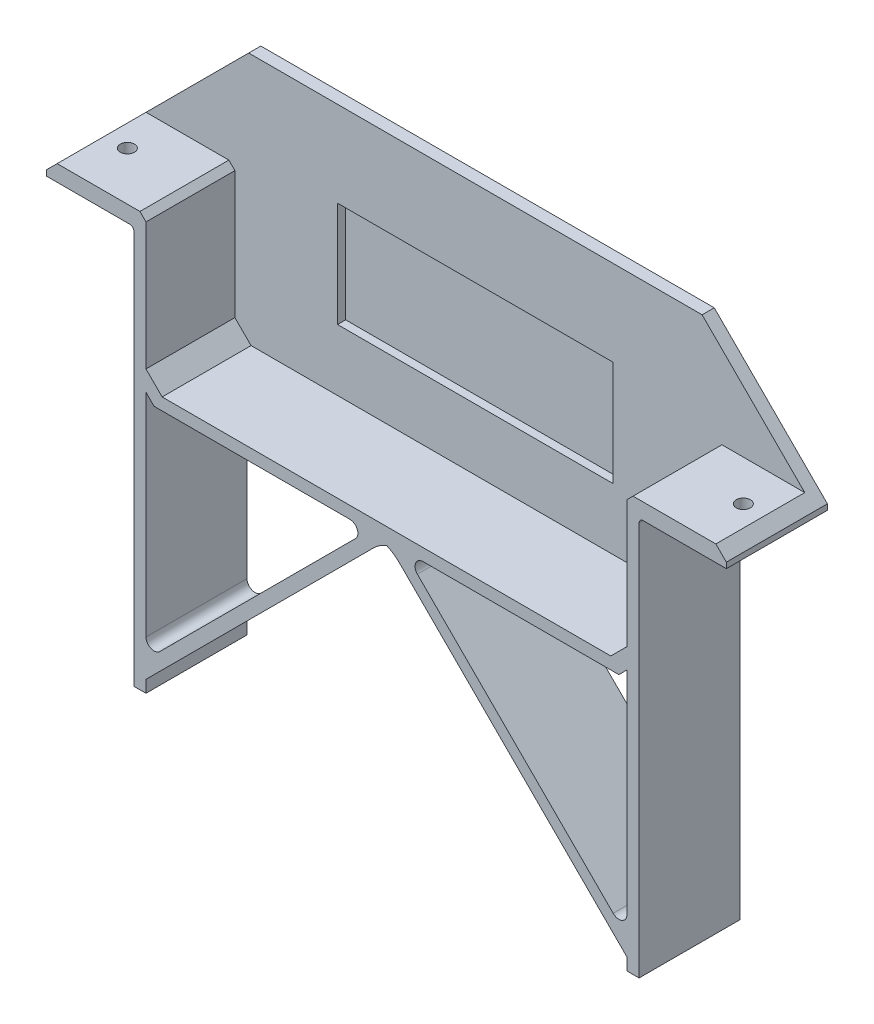
from build123d import *

# Parameters (mm, degrees)
SKETCH1_W            = 125
SKETCH1_H            = 40
BOSS_EXTRUDE1_DEPTH  = 3
SKETCH2_W            = 3
SKETCH2_H            = 40
BOSS_EXTRUDE2_DEPTH  = 22
SKETCH4_W            = 25
SKETCH4_H            = 4
BOSS_EXTRUDE4_DEPTH  = 21.59
SKETCH5_W            = 25
SKETCH5_H            = 4
BOSS_EXTRUDE5_DEPTH  = 21.59
SKETCH6_W            = 168.18
SKETCH6_H            = 25.4
BOSS_EXTRUDE6_DEPTH  = 3
CHAMFER1_SIZE        = 28
SKETCH7_W            = 68.2
SKETCH7_H            = 26
CUT_EXTRUDE1_DEPTH   = 2
SKETCH9_W            = 119
SKETCH9_H            = 3
BOSS_EXTRUDE7_DEPTH  = 22
CHAMFER2_SIZE        = 4
CHAMFER3_SIZE        = 5
SKETCH11_R           = 1.75
CUT_EXTRUDE3_DEPTH   = 5
FILLET1_R            = 1
CHAMFER4_SIZE        = 1.5
BOSS_EXTRUDE10_DEPTH = 25
FILLET2_R            = 10
FILLET3_R            = 2
FILLET4_R            = 2


with BuildPart() as part:
    # Sketch1 → Boss-Extrude1 (new body)
    with BuildSketch(Plane.XY):
        Rectangle(SKETCH1_W, SKETCH1_H)
    extrude(amount=BOSS_EXTRUDE1_DEPTH)

    # Sketch2 → Boss-Extrude2 (add)
    with BuildSketch(Plane.XY.offset(3)):
        with Locations((-61, 0)):
            Rectangle(SKETCH2_W, SKETCH2_H)
        with Locations((61, 0)):
            Rectangle(SKETCH2_W, SKETCH2_H)
    extrude(amount=BOSS_EXTRUDE2_DEPTH)

    # Sketch4 → Boss-Extrude4 (add)
    with BuildSketch(Plane.ZY.offset(62.5)):
        with Locations((12.5, 18)):
            Rectangle(SKETCH4_W, SKETCH4_H)
    extrude(amount=BOSS_EXTRUDE4_DEPTH)

    # Sketch5 → Boss-Extrude5 (add)
    with BuildSketch(Plane(origin=(62.5, 0, 0), x_dir=(0, 0, -1), z_dir=(1, 0, 0))):
        with Locations((-12.5, 18)):
            Rectangle(SKETCH5_W, SKETCH5_H)
    extrude(amount=BOSS_EXTRUDE5_DEPTH)

    # Sketch6 → Boss-Extrude6 (add)
    with BuildSketch(Plane(origin=(0, 0, 0), x_dir=(-1, 0, 0), z_dir=(0, 0, -1))):
        with Locations((0, 32.7)):
            Rectangle(SKETCH6_W, SKETCH6_H)
    extrude(amount=-BOSS_EXTRUDE6_DEPTH)

    # Chamfer1
    chamfer1_edges = [part.edges().sort_by_distance(p)[0] for p in [
        (-84.09, 45.4, 1.5),
        (84.09, 45.4, 1.5),
    ]]
    chamfer(chamfer1_edges, length=CHAMFER1_SIZE)

    # Sketch7 → Cut-Extrude1 (cut)
    with BuildSketch(Plane.XY.offset(3)):
        with Locations((0, 11.217156681)):
            Rectangle(SKETCH7_W, SKETCH7_H)
    extrude(amount=-CUT_EXTRUDE1_DEPTH, mode=Mode.SUBTRACT)

    # Sketch9 → Boss-Extrude7 (add)
    with BuildSketch(Plane.XY.offset(3)):
        with Locations((0, -18.5)):
            Rectangle(SKETCH9_W, SKETCH9_H)
    extrude(amount=BOSS_EXTRUDE7_DEPTH)

    # Chamfer2
    chamfer2_edges = [part.edges().sort_by_distance(p)[0] for p in [
        (-59.5, -17, 14),
        (59.5, -17, 14),
    ]]
    chamfer(chamfer2_edges, length=CHAMFER2_SIZE)

    # Chamfer3
    chamfer3_edges = [part.edges().sort_by_distance(p)[0] for p in [
        (62.5, -20, 12.5),
        (-62.5, -20, 12.5),
    ]]
    chamfer(chamfer3_edges, length=CHAMFER3_SIZE)

    # Sketch11 → Cut-Extrude3 (cut)
    with BuildSketch(Plane(origin=(0, 20, 0), x_dir=(1, 0, 0), z_dir=(0, 1, 0))):
        with Locations(Location((-76.11, -13, 0), (0, 0, 270))):
            Circle(SKETCH11_R)
        with Locations(Location((76.29, -13, 0), (0, 0, 270))):
            Circle(SKETCH11_R)
    extrude(amount=-CUT_EXTRUDE3_DEPTH, mode=Mode.SUBTRACT)

    # Fillet1
    fillet1_edges = [part.edges().sort_by_distance(p)[0] for p in [
        (-62.5, 16, 12.5),
        (62.5, 16, 12.5),
    ]]
    fillet(fillet1_edges, radius=FILLET1_R)

    # Chamfer4
    chamfer4_edges = [part.edges().sort_by_distance(p)[0] for p in [
        (-59.5, 20, 14),
        (59.5, 20, 14),
    ]]
    chamfer(chamfer4_edges, length=CHAMFER4_SIZE)

    # Sketch12 → Boss-Extrude10 (add)
    with BuildSketch(Plane.XY.offset(25)):
        Polygon((-0.275787659, -20.275787659), (-59.5, -79.5), (-59.5, -82.5), (-62.5, -82.5), (-62.5, -15), (-59.5, -15), (-59.5, -75.257359313), (-4.242640687, -20), (0, -20), (4.242640687, -20), (59.5, -75.257359313), (59.5, -15), (62.5, -15), (62.5, -82.5), (59.5, -82.5), (59.5, -79.5), (0.275787659, -20.275787659), align=None)
    extrude(amount=-BOSS_EXTRUDE10_DEPTH)

    # Fillet2
    # the kernel refuses this fillet: 10 mm, written as the material it adds along each edge
    with BuildSketch(Plane(origin=(0.275787659, -20.275787659, 25), x_dir=(0.7071067811865169, -0.7071067811865782, 0), z_dir=(0, 0, -1)), Plane(origin=(-0.275787659, -20.275787659, 25), x_dir=(1, 0, 0), z_dir=(0, 0, -1))) as fillet2_piece_1:
        with BuildLine():
            CenterArc((FILLET2_R * 0.414213562373, FILLET2_R), FILLET2_R, 225, 45)
            Line((-FILLET2_R * 0.292893218813, FILLET2_R * 0.292893218813), (0, 0))
            Line((0, 0), (FILLET2_R * 0.414213562373, 0))
        make_face()
    extrude(amount=25)

    # Fillet3
    fillet3_edges = [part.edges().sort_by_distance(p)[0] for p in [
        (59.5, -75.257359313, 12.5),
        (-59.5, -75.257359313, 12.5),
    ]]
    fillet(fillet3_edges, radius=FILLET3_R)

    # Fillet4
    fillet4_edges = [part.edges().sort_by_distance(p)[0] for p in [
        (-4.242640687, -20, 12.5),
        (4.242640687, -20, 12.5),
    ]]
    fillet(fillet4_edges, radius=FILLET4_R)


solid = part.part
